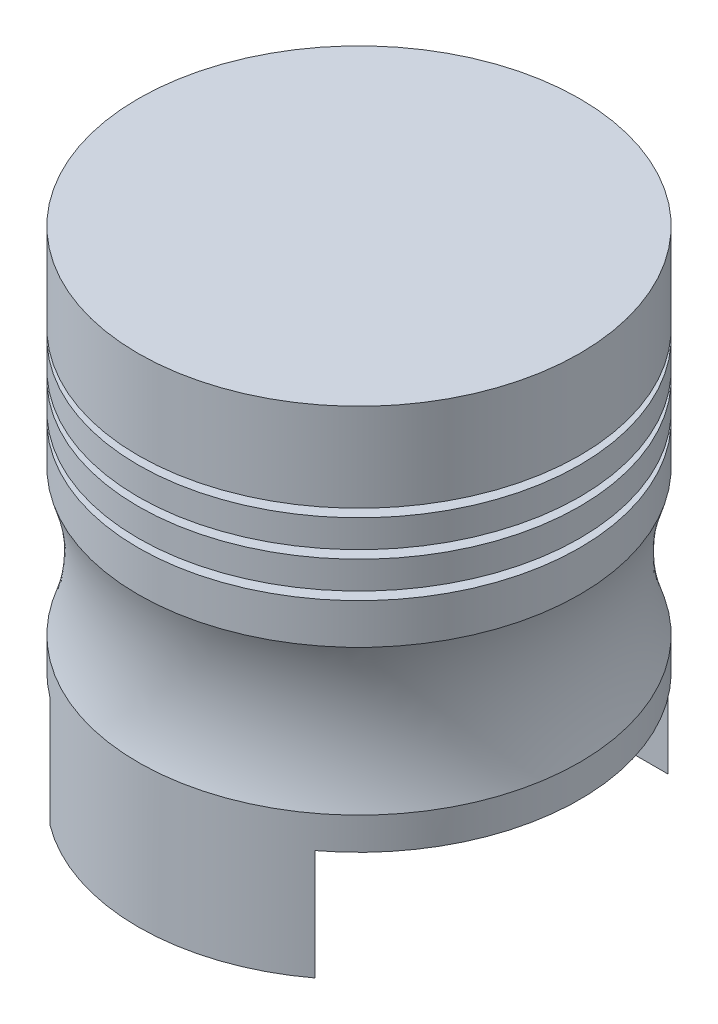
from build123d import *

# Parameters (mm, degrees)
SKETCH2_W                = 40
SKETCH2_H                = 70
SKETCH4_W                = 40
SKETCH4_H                = 20
CUT_EXTRUDE1_DEPTH       = 51
CUT_EXTRUDE1_DEPTH_BACK  = 47
SKETCH5_W                = 64
SKETCH5_H                = 20
BOSS_EXTRUDE1_DEPTH      = 4
BOSS_EXTRUDE1_DEPTH_BACK = 4
SKETCH3_R                = 5
FILLET2_R                = 5
FILLET3_R                = 5
CUT_EXTRUDE2_DEPTH       = 60
SKETCH8_W                = 3
SKETCH8_H                = 1.5


with BuildPart() as part:
    # Sketch2 → Revolve1 (revolve)
    with BuildSketch(Plane(origin=(0, 0, 0), x_dir=(0, 0, -1), z_dir=(1, 0, 0)), mode=Mode.PRIVATE) as revolve1_sk:
        with Locations((20, 91.106067618)):
            Rectangle(SKETCH2_W, SKETCH2_H)
    revolve(revolve1_sk.sketch.rotate(Axis((0, 126.106067618, 0), (0, -1, 0)), 180), axis=Axis((0, 126.106067618, 0), (0, -1, 0)))

    # Sketch4 → Revolve2 (revolve)
    with BuildSketch(Plane(origin=(0, 0, 0), x_dir=(0, 0, -1), z_dir=(1, 0, 0)), mode=Mode.PRIVATE) as revolve2_sk:
        with Locations((20, 46.106067618)):
            Rectangle(SKETCH4_W, SKETCH4_H)
    revolve(revolve2_sk.sketch.rotate(Axis((0, 56.106067618, 0), (0, -1, 0)), 180), axis=Axis((0, 56.106067618, 0), (0, -1, 0)))

    # Sketch5 → Cut-Extrude1 (cut, two sides: drawn at the far end of the back side and taken through both)
    with BuildSketch(Plane(origin=(0, 0, 0), x_dir=(0, 0, -1), z_dir=(1, 0, 0)).offset(-CUT_EXTRUDE1_DEPTH_BACK)):
        with Locations((0, 46.106067618)):
            Rectangle(SKETCH5_W, SKETCH5_H)
    extrude(amount=CUT_EXTRUDE1_DEPTH + CUT_EXTRUDE1_DEPTH_BACK, mode=Mode.SUBTRACT)

    # Sketch3 → Boss-Extrude1 (add, two sides: drawn at the far end of the back side and taken through both)
    with BuildSketch(Plane(origin=(0, 0, 0), x_dir=(0, 0, -1), z_dir=(1, 0, 0)).offset(-BOSS_EXTRUDE1_DEPTH_BACK)):
        with BuildLine():
            Line((-32, 56.106067618), (-14.456832295, 56.106067618))
            Line((-14.456832295, 56.106067618), (14.456832295, 56.106067618))
            Line((14.456832295, 56.106067618), (32, 56.106067618))
            Line((32, 56.106067618), (32, 36.106067618))
            ThreePointArc((32, 36.106067618), (25.399471898, 38.812393939), (19.624541582, 43.00063381))
            ThreePointArc((19.624541582, 43.00063381), (15.729589271, 44.305817394), (12.171473884, 42.25302111))
            ThreePointArc((12.171473884, 42.25302111), (0, 36.019732208), (-12.171473884, 42.25302111))
            ThreePointArc((-12.171473884, 42.25302111), (-15.729589271, 44.305817394), (-19.624541582, 43.00063381))
            ThreePointArc((-19.624541582, 43.00063381), (-25.399471898, 38.812393939), (-32, 36.106067618))
            Line((-32, 36.106067618), (-32, 56.106067618))
        make_face()
        with Locations((0, 45.417119487)):
            Circle(SKETCH3_R, mode=Mode.SUBTRACT)
    extrude(amount=BOSS_EXTRUDE1_DEPTH + BOSS_EXTRUDE1_DEPTH_BACK)

    # Fillet2
    # the kernel refuses this fillet: 5 mm, written as the material it adds along each edge
    with BuildSketch(Plane(origin=(4, 36.106067618, 32), x_dir=(1, 0, 0), z_dir=(0, 1, 0))) as fillet2_piece_1_section:
        with BuildLine():
            CenterArc((FILLET2_R, FILLET2_R), FILLET2_R, 180, 90)
            Line((0, FILLET2_R), (0, 0))
            Line((0, 0), (FILLET2_R, 0))
        make_face()
    fillet2_piece_1 = extrude(amount=32.5, mode=Mode.PRIVATE)
    fillet2_piece_1 = fillet2_piece_1 & Plane(origin=(5.143552766, 65.019732208, 40), x_dir=(0, -0.7339699466021848, -0.6791819472606629), z_dir=(-1, 0, 0)) * Cylinder(30, 85, mode=Mode.PRIVATE)
    add(fillet2_piece_1)

    # Fillet3
    # the kernel refuses this fillet: 5 mm, written as the material it adds along each edge
    with BuildSketch(Plane(origin=(-4, 36.106067618, 32), x_dir=(0, 0, -1), z_dir=(0, 1, 0))) as fillet3_piece_1_section:
        with BuildLine():
            CenterArc((FILLET3_R, FILLET3_R), FILLET3_R, 180, 90)
            Line((0, FILLET3_R), (0, 0))
            Line((0, 0), (FILLET3_R, 0))
        make_face()
    fillet3_piece_1 = extrude(amount=32.5, mode=Mode.PRIVATE)
    fillet3_piece_1 = fillet3_piece_1 & Plane(origin=(-5.143552934, 65.019732208, 40), x_dir=(0, -0.7339699466019316, -0.6791819472609367), z_dir=(-1, 0, 0)) * Cylinder(30, 85, mode=Mode.PRIVATE)
    add(fillet3_piece_1)
    with BuildSketch(Plane(origin=(-4, 68.606067618, -32), x_dir=(0, 0, 1), z_dir=(0, -1, 0))) as fillet3_piece_2_section:
        with BuildLine():
            CenterArc((FILLET3_R, FILLET3_R), FILLET3_R, 180, 90)
            Line((0, FILLET3_R), (0, 0))
            Line((0, 0), (FILLET3_R, 0))
        make_face()
    fillet3_piece_2 = extrude(amount=32.5, mode=Mode.PRIVATE)
    fillet3_piece_2 = fillet3_piece_2 & Plane(origin=(-5.131975571, 65.019732208, -40), x_dir=(0, -0.9637888196533986, 0.26666666666666256), z_dir=(-1, 0, 0)) * Cylinder(30, 85, mode=Mode.PRIVATE)
    add(fillet3_piece_2)
    with BuildSketch(Plane(origin=(4, 68.606067618, -32), x_dir=(0, 0, 1), z_dir=(0, -1, 0))) as fillet3_piece_3_section:
        with BuildLine():
            CenterArc((FILLET3_R, -FILLET3_R), FILLET3_R, 90, 90)
            Line((0, -FILLET3_R), (0, 0))
            Line((0, 0), (FILLET3_R, 0))
        make_face()
    fillet3_piece_3 = extrude(amount=32.5, mode=Mode.PRIVATE)
    fillet3_piece_3 = fillet3_piece_3 & Plane(origin=(5.131975571, 65.019732208, -40), x_dir=(0, -0.9637888196533986, 0.26666666666666256), z_dir=(-1, 0, 0)) * Cylinder(30, 85, mode=Mode.PRIVATE)
    add(fillet3_piece_3)

    # Sketch7 → Cut-Extrude2 (cut)
    with BuildSketch(Plane.XZ.offset(-56.106067618)):
        with BuildLine():
            Line((-4, -22), (-4, 22))
            ThreePointArc((-4, 22), (-5.464466094, 25.535533906), (-9, 27))
            Line((-9, 27), (-22.759731635, 27))
            ThreePointArc((-22.759731635, 27), (-24.875929217, 26.530089159), (-26.594357126, 25.208683117))
            ThreePointArc((-26.594357126, 25.208683117), (-35.75, 0), (-26.594357126, -25.208683117))
            ThreePointArc((-26.594357126, -25.208683117), (-24.875929217, -26.530089159), (-22.759731635, -27))
            Line((-22.759731635, -27), (-9, -27))
            ThreePointArc((-9, -27), (-5.464466094, -25.535533906), (-4, -22))
        make_face()
        with BuildLine():
            Line((9, -27), (22.759731635, -27))
            ThreePointArc((22.759731635, -27), (24.875929217, -26.530089159), (26.594357126, -25.208683117))
            ThreePointArc((26.594357126, -25.208683117), (35.75, 0), (26.594357126, 25.208683117))
            ThreePointArc((26.594357126, 25.208683117), (24.875929217, 26.530089159), (22.759731635, 27))
            Line((22.759731635, 27), (9, 27))
            ThreePointArc((9, 27), (5.464466094, 25.535533906), (4, 22))
            Line((4, 22), (4, -22))
            ThreePointArc((4, -22), (5.464466094, -25.535533906), (9, -27))
        make_face()
    extrude(amount=-CUT_EXTRUDE2_DEPTH, mode=Mode.SUBTRACT)

    # Sketch8 → Cut-Revolve1 (revolve, cut)
    with BuildSketch(Plane(origin=(0, 0, 0), x_dir=(0, 0, -1), z_dir=(1, 0, 0))):
        with Locations((38.5, 109.356067618)):
            Rectangle(SKETCH8_W, SKETCH8_H)
        with Locations((38.5, 102.856067618)):
            Rectangle(SKETCH8_W, SKETCH8_H)
        with BuildLine():
            Line((40, 61.941769102), (40, 88.270366135))
            ThreePointArc((40, 88.270366135), (37.711050715, 75.106067618), (40, 61.941769102))
        make_face()
        with Locations((38.5, 96.356067618)):
            Rectangle(SKETCH8_W, SKETCH8_H)
    revolve(axis=Axis((0, 45.417119487, 0), (0, 1, 0)), mode=Mode.SUBTRACT)


solid = part.part
